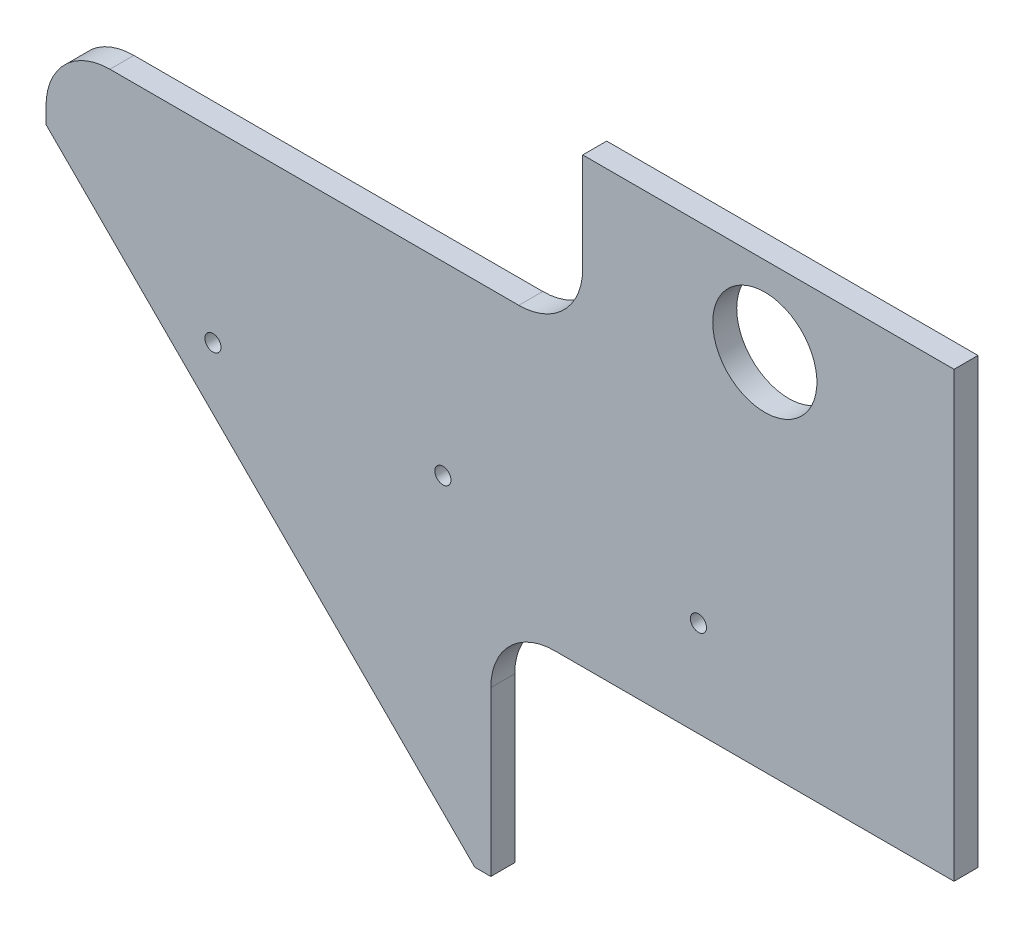
from build123d import *

# Parameters (mm, degrees)
SKETCH1_R                  = 20.701
BOSS_EXTRUDE1_DEPTH        = 9.525
SKETCH2_W                  = 184.15
SKETCH2_H                  = 90.42146
CUT_EXTRUDE1_DEPTH         = 267.045158533
FILLET1_R                  = 25.4
SKETCH4_W                  = 213.36
SKETCH4_H                  = 64.479988722
CUT_EXTRUDE2_DEPTH         = 267.045158533
FILLET2_R                  = 25.4
F_6_4_6_4_DIAMETER_HOLE2_D = 6.4


with BuildPart() as part:
    # Sketch1 → Boss-Extrude1 (new body)
    with BuildSketch(Plane.XY):
        Polygon((-138.259383474, 48.991487021), (32.210627804, -121.478524257), (222.710627804, -121.478524257), (222.710627804, 145.221475743), (-138.259383474, 145.221475743), align=None)
        with Locations((147.490616526, 113.471475743)):
            Circle(SKETCH1_R, mode=Mode.SUBTRACT)
    extrude(amount=BOSS_EXTRUDE1_DEPTH)

    # Sketch2 → Cut-Extrude1 (cut, through all)
    with BuildSketch(Plane.XY.offset(9.525)):
        with Locations((130.635627804, -76.267794257)):
            Rectangle(SKETCH2_W, SKETCH2_H)
    extrude(amount=-CUT_EXTRUDE1_DEPTH, mode=Mode.SUBTRACT)

    # Fillet1
    fillet1_edges = [part.edges().sort_by_distance(p)[0] for p in [
        (38.560627804, -31.057064257, 4.7625),
    ]]
    fillet(fillet1_edges, radius=FILLET1_R)

    # Sketch4 → Cut-Extrude2 (cut, through all)
    with BuildSketch(Plane.XY.offset(9.525)):
        with Locations((-31.579383474, 112.981481382)):
            Rectangle(SKETCH4_W, SKETCH4_H)
    extrude(amount=-CUT_EXTRUDE2_DEPTH, mode=Mode.SUBTRACT)

    # Fillet2
    fillet2_edges = [part.edges().sort_by_distance(p)[0] for p in [
        (-138.259383474, 80.741487021, 4.7625),
        (75.100616526, 80.741487021, 4.7625),
    ]]
    fillet(fillet2_edges, radius=FILLET2_R)

    # Ø6.4 (6.4) Diameter Hole2 (through all)
    with Locations(Plane(origin=(0, 0, 0), x_dir=(-1, 0, 0), z_dir=(0, 0, -1))):
        with Locations((-121.110627804, 7.042935743), (-19.510627804, 7.042935743), (71.895728372, 7.042935743)):
            Hole(F_6_4_6_4_DIAMETER_HOLE2_D / 2)


solid = part.part
